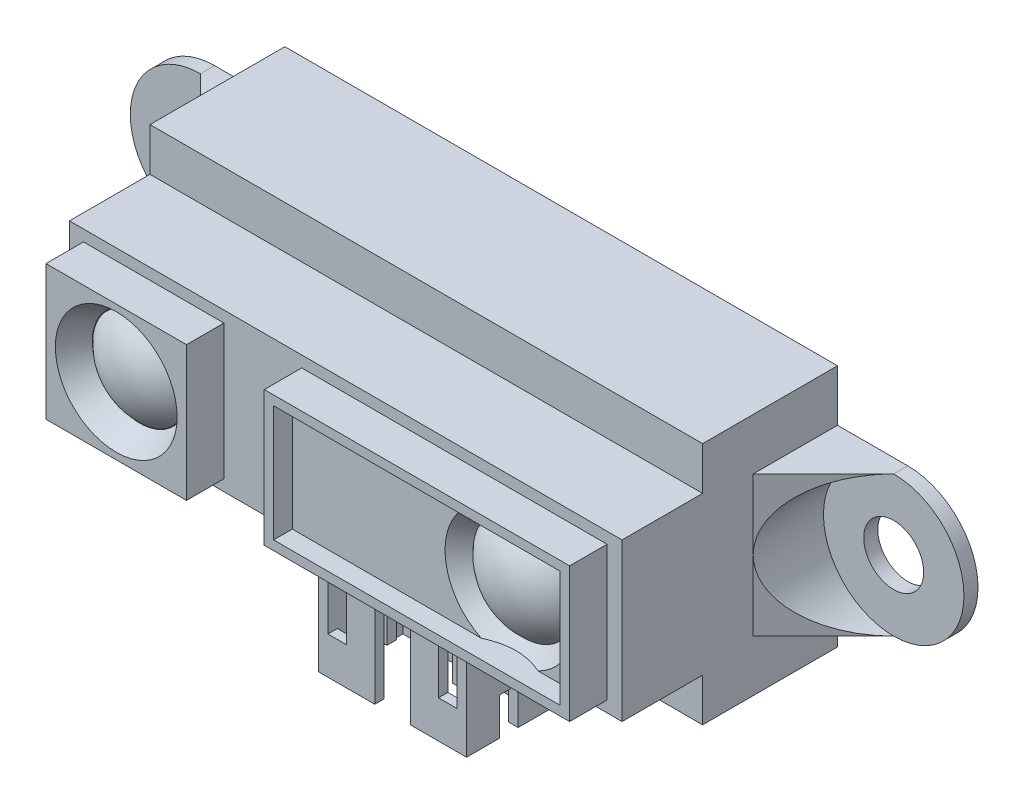
from build123d import *

# Parameters (mm, degrees)
BOSS_EXTRUDE5_DEPTH  = 14.75
SKETCH9_W            = 7.5
SKETCH9_H            = 7.2
SKETCH9_W_2          = 16.3
BOSS_EXTRUDE6_DEPTH  = 2
SKETCH10_W           = 15.3
SKETCH10_H           = 6.2
CUT_EXTRUDE4_DEPTH   = 1
SKETCH11_R           = 2.5
CUT_EXTRUDE5_DEPTH   = 1.25
BOSS_EXTRUDE7_DEPTH  = 4.5
CUT_EXTRUDE7_START   = -7.5
CUT_EXTRUDE7_DEPTH   = 7.5
SKETCH18_R           = 3.75
CUT_EXTRUDE8_DEPTH   = 4.5
SKETCH19_R           = 1.6
CUT_EXTRUDE9_DEPTH   = 4.5
CHAMFER1_SIZE        = 0.75
CHAMFER1_SIZE_2      = 1.299038106
SKETCH13_R           = 2.7
CUT_EXTRUDE6_DEPTH   = 1
CHAMFER2_SIZE        = 0.75
SKETCH20_W           = 10.01
SKETCH20_H           = 1.2
BOSS_EXTRUDE8_DEPTH  = 5.9
SKETCH21_W           = 7.9
SKETCH21_H           = 4.5
BOSS_EXTRUDE9_DEPTH  = 6
SKETCH23_W           = 6.9
SKETCH23_H           = 3.5
CUT_EXTRUDE11_DEPTH  = 5.5
SKETCH24_W           = 1.9
SKETCH24_H           = 5.5
SKETCH24_W_2         = 1
SKETCH24_H_2         = 4
CUT_EXTRUDE12_DEPTH  = 0.5
CUT_EXTRUDE13_REACH  = 34.015
SKETCH25_W           = 1
SKETCH25_H           = 2
SKETCH26_W           = 0.5
SKETCH26_H           = 0.5
BOSS_EXTRUDE10_DEPTH = 4
CHAMFER3_SIZE        = 0.1
LPATTERN1_COUNT      = 3
LPATTERN1_PITCH      = 2


# Read off the part's stored shape, not the designer's step: Cut-Extrude7
with BuildPart() as part:
    # Sketch8 → Boss-Extrude5 (new, symmetric)
    with BuildSketch(Plane(origin=(0, 0, 0), x_dir=(0, 0, -1), z_dir=(1, 0, 0))):
        Polygon((0, -6.5), (0, 6.5), (-7.2, 6.5), (-7.2, 4.2), (-11.5, 4.2), (-11.5, -4.2), (-7.2, -4.2), (-7.2, -6.5), align=None)
    extrude(amount=BOSS_EXTRUDE5_DEPTH, both=True)

    # Sketch9 → Boss-Extrude6 (add)
    with BuildSketch(Plane.XY.offset(11.5)):
        with Locations((-10.25, 0)):
            Rectangle(SKETCH9_W, SKETCH9_H)
        with Locations((5.8, 0)):
            Rectangle(SKETCH9_W_2, SKETCH9_H)
    extrude(amount=BOSS_EXTRUDE6_DEPTH)

    # Sketch10 → Cut-Extrude4 (cut)
    with BuildSketch(Plane.XY.offset(13.5)):
        with Locations((5.8, 0)):
            Rectangle(SKETCH10_W, SKETCH10_H)
    extrude(amount=-CUT_EXTRUDE4_DEPTH, mode=Mode.SUBTRACT)

    # Sketch11 → Cut-Extrude5 (cut)
    with BuildSketch(Plane.XY.offset(13.5)):
        with Locations((-10.25, 0)):
            Circle(SKETCH11_R)
    extrude(amount=-CUT_EXTRUDE5_DEPTH, mode=Mode.SUBTRACT)

    # Sketch16 → Boss-Extrude7 (add)
    with BuildSketch(Plane(origin=(0, 0, 0), x_dir=(-1, 0, 0), z_dir=(0, 0, -1))):
        with BuildLine():
            Line((-14.75, -3.75), (-14.75, 3.75))
            Line((-14.75, 3.75), (-18.5, 3.75))
            ThreePointArc((-18.5, 3.75), (-22.25, 0), (-18.5, -3.75))
            Line((-18.5, -3.75), (-14.75, -3.75))
        make_face()
    boss_extrude7 = extrude(amount=-BOSS_EXTRUDE7_DEPTH)

    # Cut-Extrude7 outline → Cut-Extrude7 (cut)
    with BuildSketch(Plane.XZ.offset(3.75).offset(CUT_EXTRUDE7_START)):
        Polygon((14.75, 4.5), (18.5, 0.75), (24, 0.75), (24, 4.5), align=None)
    cut_extrude7 = extrude(amount=CUT_EXTRUDE7_DEPTH, mode=Mode.SUBTRACT)

    # Sketch18 → Cut-Extrude8 (cut)
    with BuildSketch(Plane.XY.offset(0.75)):
        with Locations((18.5, 0)):
            Circle(SKETCH18_R)
    cut_extrude8 = extrude(amount=CUT_EXTRUDE8_DEPTH, mode=Mode.SUBTRACT)

    # Sketch19 → Cut-Extrude9 (cut)
    with BuildSketch(Plane.XY.offset(0.75)):
        with Locations((18.5, 0)):
            Circle(SKETCH19_R)
    cut_extrude9 = extrude(amount=-CUT_EXTRUDE9_DEPTH, mode=Mode.SUBTRACT)

    # Mirror1: Boss-Extrude7, Cut-Extrude7, Cut-Extrude8, Cut-Extrude9 across plane
    add(boss_extrude7.mirror(Plane(origin=(0, 0, 0), x_dir=(0, 0, 1), z_dir=(1, 0, 0))))
    add(cut_extrude7.mirror(Plane(origin=(0, 0, 0), x_dir=(0, 0, 1), z_dir=(1, 0, 0))), mode=Mode.SUBTRACT)
    add(cut_extrude8.mirror(Plane(origin=(0, 0, 0), x_dir=(0, 0, 1), z_dir=(1, 0, 0))), mode=Mode.SUBTRACT)
    add(cut_extrude9.mirror(Plane(origin=(0, 0, 0), x_dir=(0, 0, 1), z_dir=(1, 0, 0))), mode=Mode.SUBTRACT)

    # Chamfer1
    # the kernel refuses this chamfer: 1.299038106, 0.75 mm, written as the material it takes off along each edge
    with BuildSketch(Plane(origin=(-10.25, 0, 13.5), x_dir=(1, 0, 0), z_dir=(0, -1, 0))) as chamfer1_piece_1_section:
        Polygon((2.5 + CHAMFER1_SIZE, 0), (2.5, -CHAMFER1_SIZE_2), (2.5, 0), align=None)
    chamfer1_piece_1 = revolve(axis=Axis((-10.25, 0, 13.5), (0, 0, 1)), mode=Mode.PRIVATE)
    chamfer1_piece_1 = split(chamfer1_piece_1, bisect_by=Plane(origin=(-13.133837987, 0, 12.25), z_dir=(0, 0, 1)), keep=Keep.TOP, mode=Mode.PRIVATE)
    add(chamfer1_piece_1, mode=Mode.SUBTRACT)

    # Sketch13 → Cut-Extrude6 (cut)
    with BuildSketch(Plane.XY.offset(12.5)):
        with Locations((9.75, 0)):
            Circle(SKETCH13_R)
    extrude(amount=-CUT_EXTRUDE6_DEPTH, mode=Mode.SUBTRACT)

    # Chamfer2
    # the kernel refuses this chamfer: 0.75 mm, written as the material it takes off along each edge
    with BuildSketch(Plane(origin=(9.75, 0, 12.5), x_dir=(1, 0, 0), z_dir=(0, -1, 0))) as chamfer2_piece_1_section:
        Polygon((2.7 + CHAMFER2_SIZE, 0), (2.7, -CHAMFER2_SIZE), (2.7, 0), align=None)
    chamfer2_piece_1 = revolve(axis=Axis((9.75, 0, 12.5), (0, 0, 1)), mode=Mode.PRIVATE)
    chamfer2_piece_1 = split(chamfer2_piece_1, bisect_by=Plane(origin=(6.68747717, -3.1, 12.13747717), z_dir=(0, 1, 0)), keep=Keep.TOP, mode=Mode.PRIVATE)
    chamfer2_piece_1 = split(chamfer2_piece_1, bisect_by=Plane(origin=(6.68747717, 3.1, 12.13747717), z_dir=(0, -1, 0)), keep=Keep.TOP, mode=Mode.PRIVATE)
    add(chamfer2_piece_1, mode=Mode.SUBTRACT)


with BuildPart() as body_2:
    # Sketch12 → Revolve1 (revolve)
    with BuildSketch(Plane.ZY.offset(10.25), mode=Mode.PRIVATE) as revolve1_sk:
        with BuildLine():
            Line((12.25, 2.5), (12.25, 0))
            Line((12.25, 0), (13.351165831, 0))
            ThreePointArc((13.351165831, 0), (13.063678836, 1.365884895), (12.25, 2.5))
        make_face()
    revolve(revolve1_sk.sketch.rotate(Axis((-10.25, 0, 12.25), (0, 0, 1)), 180), axis=Axis((-10.25, 0, 12.25), (0, 0, 1)))


with BuildPart() as body_3:
    # Sketch15 → Revolve2 (revolve)
    with BuildSketch(Plane(origin=(0, 0, 0), x_dir=(1, 0, 0), z_dir=(0, 1, 0))):
        with BuildLine():
            Line((9.75, -11.5), (9.75, -13))
            ThreePointArc((9.75, -13), (8.262342445, -12.672340318), (7.05, -11.75))
            Line((7.05, -11.75), (7.05, -11.5))
            Line((7.05, -11.5), (9.75, -11.5))
        make_face()
    revolve(axis=Axis((9.75, 0, 13), (0, 0, -1)))


with BuildPart() as body_4:
    # Sketch20 → Boss-Extrude8 (new body)
    with BuildSketch(Plane.XZ.offset(6.5)):
        with Locations((0, 3.9)):
            Rectangle(SKETCH20_W, SKETCH20_H)
    extrude(amount=BOSS_EXTRUDE8_DEPTH)


with BuildPart() as body_5:
    # Sketch21 → Boss-Extrude9 (new body)
    with BuildSketch(Plane.XZ.offset(6.5)):
        with Locations((0, 6.75)):
            Rectangle(SKETCH21_W, SKETCH21_H)
    extrude(amount=BOSS_EXTRUDE9_DEPTH)

    # Sketch23 → Cut-Extrude11 (cut)
    with BuildSketch(Plane.XZ.offset(12.5)):
        with Locations((0, 6.75)):
            Rectangle(SKETCH23_W, SKETCH23_H)
    extrude(amount=-CUT_EXTRUDE11_DEPTH, mode=Mode.SUBTRACT)

    # Sketch24 → Cut-Extrude12 (cut)
    with BuildSketch(Plane.XY.offset(9)):
        with Locations((0, -9.75)):
            Rectangle(SKETCH24_W, SKETCH24_H)
        with Locations((-2.95, -8.5)):
            Rectangle(SKETCH24_W_2, SKETCH24_H_2)
        with Locations((2.95, -8.5)):
            Rectangle(SKETCH24_W_2, SKETCH24_H_2)
    extrude(amount=-CUT_EXTRUDE12_DEPTH, mode=Mode.SUBTRACT)

    # Cut-Extrude13: up to this face of the body (flat: up to its plane)
    cut_extrude13_end = Plane(body_5.part.faces().sort_by_distance((3.95, -9.5, 6.75))[0])
    # Sketch25 → Cut-Extrude13 (cut, up to the picked face)
    with BuildSketch(Plane.ZY.offset(3.95), mode=Mode.PRIVATE) as cut_extrude13_sk1:
        with Locations((6.75, -11.5)):
            Rectangle(SKETCH25_W, SKETCH25_H)
    cut_extrude13_tool1 = split(extrude(cut_extrude13_sk1.sketch, amount=-CUT_EXTRUDE13_REACH, mode=Mode.PRIVATE), bisect_by=cut_extrude13_end, keep=Keep.BOTH, mode=Mode.PRIVATE)
    add(cut_extrude13_tool1.solids().sort_by(Axis((-3.95, -11.5, 6.75), (1, 0, 0)))[0], mode=Mode.SUBTRACT)


with BuildPart() as body_6:
    # Sketch26 → Boss-Extrude10 (new body)
    with BuildSketch(Plane.XZ.offset(7)):
        with Locations((-2, 7.3)):
            Rectangle(SKETCH26_W, SKETCH26_H)
    extrude(amount=BOSS_EXTRUDE10_DEPTH)

    # Chamfer3
    chamfer3_edges = [body_6.edges().sort_by_distance(p)[0] for p in [
        (-2.25, -11, 7.3),
        (-2, -11, 7.05),
        (-1.75, -11, 7.3),
        (-2, -11, 7.55),
    ]]
    chamfer(chamfer3_edges, length=CHAMFER3_SIZE)


with BuildPart() as lpattern1_1:
    # LPattern1: pattern copy
    add(body_6.part.moved(Location(Vector(1, 0, 0) * (1 * LPATTERN1_PITCH))))


with BuildPart() as lpattern1_2:
    # LPattern1: pattern copy
    add(body_6.part.moved(Location(Vector(1, 0, 0) * (2 * LPATTERN1_PITCH))))


solid = Compound([part.part, body_2.part, body_3.part, body_4.part, body_5.part, body_6.part, lpattern1_1.part, lpattern1_2.part])
